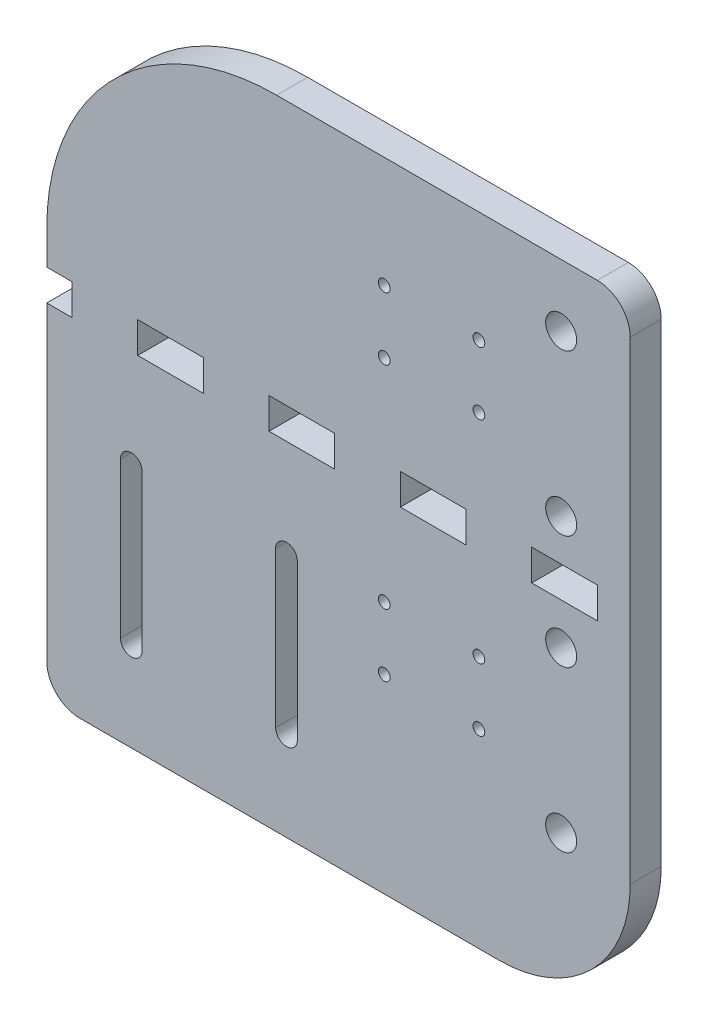
from build123d import *

# Parameters (mm, degrees)
SKETCH1_R           = 3
SKETCH1_R_2         = 1.13211215
SKETCH1_W           = 12.7
SKETCH1_H           = 5.9944
BOSS_EXTRUDE1_DEPTH = 5.9944


with BuildPart() as part:
    # Sketch1 → Boss-Extrude1 (new body)
    with BuildSketch(Plane(origin=(0, 0, 0), x_dir=(-1, 0, 0), z_dir=(0, 0, 1))):
        with BuildLine():
            Line((70.702589937, -10.904229729), (70.702589937, -4.32825998))
            Line((70.702589937, -4.32825998), (65.829579937, -4.32825998))
            Line((65.829579937, -4.32825998), (65.829579937, 1.66614002))
            Line((65.829579937, 1.66614002), (70.702589937, 1.66614002))
            Line((70.702589937, 1.66614002), (70.702589937, 61.66894002))
            ThreePointArc((70.702589937, 61.66894002), (68.842717997, 66.15906808), (64.352589937, 68.01894002))
            Line((64.352589937, 68.01894002), (-16.720420063, 68.01894002))
            ThreePointArc((-16.720420063, 68.01894002), (-34.680932306, 60.579452262), (-42.120420063, 42.61894002))
            Line((-42.120420063, 42.61894002), (-42.120420063, -49.004229729))
            ThreePointArc((-42.120420063, -49.004229729), (-40.260548124, -53.494357789), (-35.770420063, -55.354229729))
            Line((-35.770420063, -55.354229729), (26.252589937, -55.354229729))
            ThreePointArc((26.252589937, -55.354229729), (57.68348636, -42.335126153), (70.702589937, -10.904229729))
        make_face()
        with Locations((-28.770420063, -43.34064498)):
            Circle(SKETCH1_R, mode=Mode.SUBTRACT)
        with Locations((-12.862735063, -33.89562768)):
            Circle(SKETCH1_R_2, mode=Mode.SUBTRACT)
        with Locations((5.444904937, -33.89562768)):
            Circle(SKETCH1_R_2, mode=Mode.SUBTRACT)
        with Locations((-28.770420063, -12.34064498)):
            Circle(SKETCH1_R, mode=Mode.SUBTRACT)
        with Locations((-29.420420063, -1.33105998)):
            Rectangle(SKETCH1_W, SKETCH1_H, mode=Mode.SUBTRACT)
        with Locations((-12.862735063, -21.78027768)):
            Circle(SKETCH1_R_2, mode=Mode.SUBTRACT)
        with Locations((5.444904937, -21.78027768)):
            Circle(SKETCH1_R_2, mode=Mode.SUBTRACT)
        with Locations((-4.020420063, -1.33105998)):
            Rectangle(SKETCH1_W, SKETCH1_H, mode=Mode.SUBTRACT)
        with Locations((21.379579937, -1.33105998)):
            Rectangle(SKETCH1_W, SKETCH1_H, mode=Mode.SUBTRACT)
        with Locations((46.779579937, -1.33105998)):
            Rectangle(SKETCH1_W, SKETCH1_H, mode=Mode.SUBTRACT)
        with Locations((-28.770420063, 9.67852502)):
            Circle(SKETCH1_R, mode=Mode.SUBTRACT)
        with Locations((-12.862735063, 19.11815772)):
            Circle(SKETCH1_R_2, mode=Mode.SUBTRACT)
        with Locations((5.444904937, 19.11815772)):
            Circle(SKETCH1_R_2, mode=Mode.SUBTRACT)
        with Locations((-12.862735063, 31.23350772)):
            Circle(SKETCH1_R_2, mode=Mode.SUBTRACT)
        with Locations((5.444904937, 31.23350772)):
            Circle(SKETCH1_R_2, mode=Mode.SUBTRACT)
        with Locations((-28.770420063, 40.67852502)):
            Circle(SKETCH1_R, mode=Mode.SUBTRACT)
        with BuildLine():
            ThreePointArc((26.452589937, 20.66894002), (24.352589937, 18.56894002), (22.252589937, 20.66894002))
            Line((22.252589937, 20.66894002), (22.252589937, 50.66894002))
            ThreePointArc((22.252589937, 50.66894002), (24.352589937, 52.76894002), (26.452589937, 50.66894002))
            Line((26.452589937, 50.66894002), (26.452589937, 20.66894002))
        make_face(mode=Mode.SUBTRACT)
        with BuildLine():
            Line((56.452589937, 50.66894002), (56.452589937, 20.66894002))
            ThreePointArc((56.452589937, 20.66894002), (54.352589937, 18.56894002), (52.252589937, 20.66894002))
            Line((52.252589937, 20.66894002), (52.252589937, 50.66894002))
            ThreePointArc((52.252589937, 50.66894002), (54.352589937, 52.76894002), (56.452589937, 50.66894002))
        make_face(mode=Mode.SUBTRACT)
    extrude(amount=BOSS_EXTRUDE1_DEPTH)


solid = part.part
